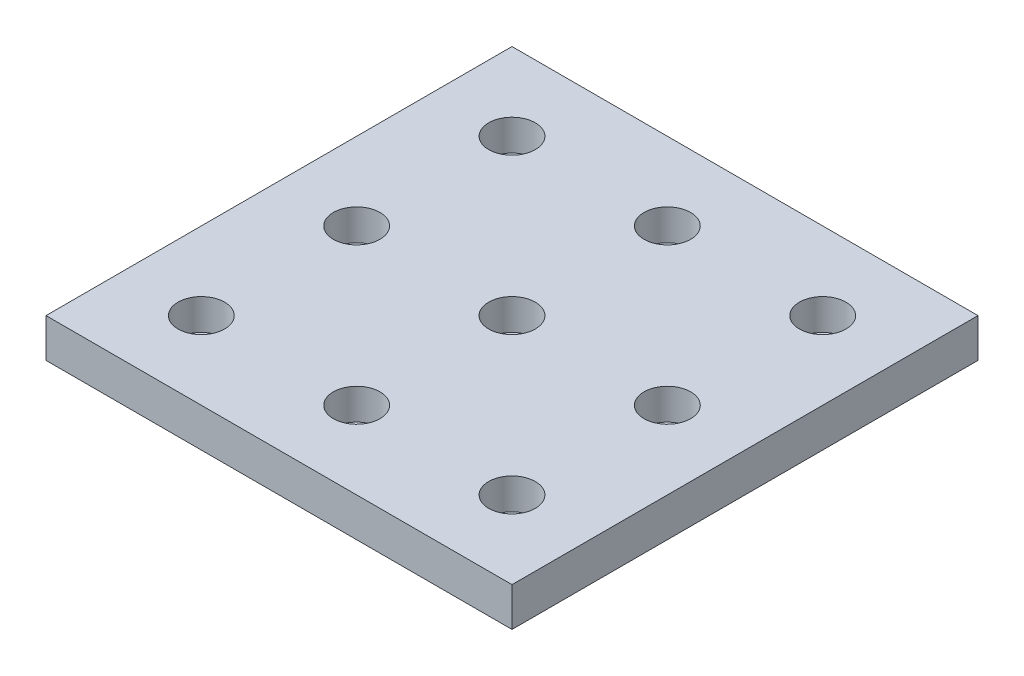
from build123d import *

# Parameters (mm, degrees)
SKETCH1_W           = 60
SKETCH1_H           = 60
SKETCH1_R           = 3
BOSS_EXTRUDE1_DEPTH = 5
SKETCH1_3_R         = 3
SKETCH1_3_R_2       = 2.5
BOSS_EXTRUDE2_DEPTH = 1


with BuildPart() as part:
    # Sketch1 → Boss-Extrude1 (new body)
    with BuildSketch(Plane(origin=(0, 0, 0), x_dir=(1, 0, 0), z_dir=(0, 1, 0))):
        with Locations((-22.911392405, 21.293363463)):
            Rectangle(SKETCH1_W, SKETCH1_H)
        with Locations((-42.911392405, 1.293363463)):
            Circle(SKETCH1_R, mode=Mode.SUBTRACT)
        with Locations((-22.911392405, 1.293363463)):
            Circle(SKETCH1_R, mode=Mode.SUBTRACT)
        with Locations((-2.911392405, 1.293363463)):
            Circle(SKETCH1_R, mode=Mode.SUBTRACT)
        with Locations((-42.911392405, 21.293363463)):
            Circle(SKETCH1_R, mode=Mode.SUBTRACT)
        with Locations((-42.911392405, 41.293363463)):
            Circle(SKETCH1_R, mode=Mode.SUBTRACT)
        with Locations((-22.911392405, 21.293363463)):
            Circle(SKETCH1_R, mode=Mode.SUBTRACT)
        with Locations((-2.911392405, 21.293363463)):
            Circle(SKETCH1_R, mode=Mode.SUBTRACT)
        with Locations((-22.911392405, 41.293363463)):
            Circle(SKETCH1_R, mode=Mode.SUBTRACT)
        with Locations((-2.911392405, 41.293363463)):
            Circle(SKETCH1_R, mode=Mode.SUBTRACT)
    extrude(amount=BOSS_EXTRUDE1_DEPTH)

    # Sketch1<3> → Boss-Extrude2 (add)
    # profile 1 of 9: a face of its own
    with BuildSketch(Plane(origin=(0, 0, 0), x_dir=(1, 0, 0), z_dir=(0, 1, 0))):
        with Locations((-42.911392405, 41.293363463)):
            Circle(SKETCH1_3_R)
        with Locations((-42.911392405, 41.293363463)):
            Circle(SKETCH1_3_R_2, mode=Mode.SUBTRACT)
    # profile 2 of 9: a face of its own
    with BuildSketch(Plane(origin=(0, 0, 0), x_dir=(1, 0, 0), z_dir=(0, 1, 0))):
        with Locations((-22.911392405, 41.293363463)):
            Circle(SKETCH1_3_R)
        with Locations((-22.911392405, 41.293363463)):
            Circle(SKETCH1_3_R_2, mode=Mode.SUBTRACT)
    # profile 3 of 9: a face of its own
    with BuildSketch(Plane(origin=(0, 0, 0), x_dir=(1, 0, 0), z_dir=(0, 1, 0))):
        with Locations((-2.911392405, 41.293363463)):
            Circle(SKETCH1_3_R)
        with Locations((-2.911392405, 41.293363463)):
            Circle(SKETCH1_3_R_2, mode=Mode.SUBTRACT)
    # profile 4 of 9: a face of its own
    with BuildSketch(Plane(origin=(0, 0, 0), x_dir=(1, 0, 0), z_dir=(0, 1, 0))):
        with Locations((-22.911392405, 21.293363463)):
            Circle(SKETCH1_3_R)
        with Locations((-22.911392405, 21.293363463)):
            Circle(SKETCH1_3_R_2, mode=Mode.SUBTRACT)
    # profile 5 of 9: a face of its own
    with BuildSketch(Plane(origin=(0, 0, 0), x_dir=(1, 0, 0), z_dir=(0, 1, 0))):
        with Locations((-2.911392405, 21.293363463)):
            Circle(SKETCH1_3_R)
        with Locations((-2.911392405, 21.293363463)):
            Circle(SKETCH1_3_R_2, mode=Mode.SUBTRACT)
    # profile 6 of 9: a face of its own
    with BuildSketch(Plane(origin=(0, 0, 0), x_dir=(1, 0, 0), z_dir=(0, 1, 0))):
        with Locations((-22.911392405, 1.293363463)):
            Circle(SKETCH1_3_R)
        with Locations((-22.911392405, 1.293363463)):
            Circle(SKETCH1_3_R_2, mode=Mode.SUBTRACT)
    # profile 7 of 9: a face of its own
    with BuildSketch(Plane(origin=(0, 0, 0), x_dir=(1, 0, 0), z_dir=(0, 1, 0))):
        with Locations((-2.911392405, 1.293363463)):
            Circle(SKETCH1_3_R)
        with Locations((-2.911392405, 1.293363463)):
            Circle(SKETCH1_3_R_2, mode=Mode.SUBTRACT)
    # profile 8 of 9: a face of its own
    with BuildSketch(Plane(origin=(0, 0, 0), x_dir=(1, 0, 0), z_dir=(0, 1, 0))):
        with Locations((-42.911392405, 21.293363463)):
            Circle(SKETCH1_3_R)
        with Locations((-42.911392405, 21.293363463)):
            Circle(SKETCH1_3_R_2, mode=Mode.SUBTRACT)
    # profile 9 of 9: a face of its own
    with BuildSketch(Plane(origin=(0, 0, 0), x_dir=(1, 0, 0), z_dir=(0, 1, 0))):
        with Locations((-42.911392405, 1.293363463)):
            Circle(SKETCH1_3_R)
        with Locations((-42.911392405, 1.293363463)):
            Circle(SKETCH1_3_R_2, mode=Mode.SUBTRACT)
    extrude(amount=BOSS_EXTRUDE2_DEPTH)


solid = part.part
